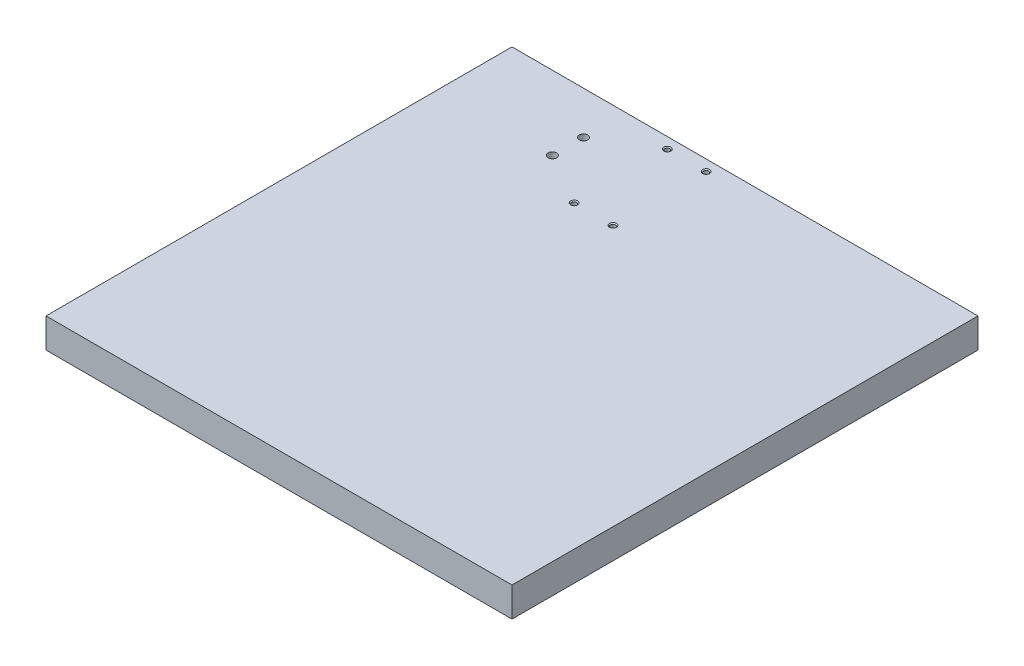
from build123d import *

# Parameters (mm, degrees)
SKETCH1_W                                           = 300
SKETCH1_H                                           = 300
BOSS_EXTRUDE1_DEPTH                                 = 19.05
M4_TAPPED_HOLE1_D                                   = 3.3
M4_TAPPED_HOLE1_DEPTH                               = 75
M4_TAPPED_HOLE1_CSINK_D                             = 4.5
M4_TAPPED_HOLE1_CSINK_ANGLE                         = 90
M4_TAPPED_HOLE1_TIP                                 = 0.991420021
CBORE_FOR_M5_HEX_SOCKET_HEAD_CAP_SCREW1_D           = 5.5
CBORE_FOR_M5_HEX_SOCKET_HEAD_CAP_SCREW1_CBORE_D     = 10
CBORE_FOR_M5_HEX_SOCKET_HEAD_CAP_SCREW1_CBORE_DEPTH = 5


with BuildPart() as part:
    # Sketch1 → Boss-Extrude1 (new body)
    with BuildSketch(Plane(origin=(0, 0, 0), x_dir=(1, 0, 0), z_dir=(0, 1, 0))):
        with Locations((150, 150)):
            Rectangle(SKETCH1_W, SKETCH1_H)
    extrude(amount=BOSS_EXTRUDE1_DEPTH)

    # M4 Tapped Hole1
    with Locations(Plane(origin=(0, 19.05, 0), x_dir=(-1, 0, 0), z_dir=(0, 1, 0))):
        with Locations((-107, -293), (-132, -293), (-132, -233), (-107, -233)):
            CounterSinkHole(M4_TAPPED_HOLE1_D / 2, M4_TAPPED_HOLE1_CSINK_D / 2, depth=M4_TAPPED_HOLE1_DEPTH, counter_sink_angle=M4_TAPPED_HOLE1_CSINK_ANGLE)
            with Locations((0, 0, -(M4_TAPPED_HOLE1_DEPTH + M4_TAPPED_HOLE1_TIP / 2))):  # 118° drill point
                Cone(0, M4_TAPPED_HOLE1_D / 2, M4_TAPPED_HOLE1_TIP, mode=Mode.SUBTRACT)

    # CBORE for M5 Hex Socket Head Cap Screw1 (through all)
    with Locations(Plane.XZ):
        with Locations((73.5, -272.5), (73.5, -252.5)):
            CounterBoreHole(CBORE_FOR_M5_HEX_SOCKET_HEAD_CAP_SCREW1_D / 2, CBORE_FOR_M5_HEX_SOCKET_HEAD_CAP_SCREW1_CBORE_D / 2, CBORE_FOR_M5_HEX_SOCKET_HEAD_CAP_SCREW1_CBORE_DEPTH)


solid = part.part
